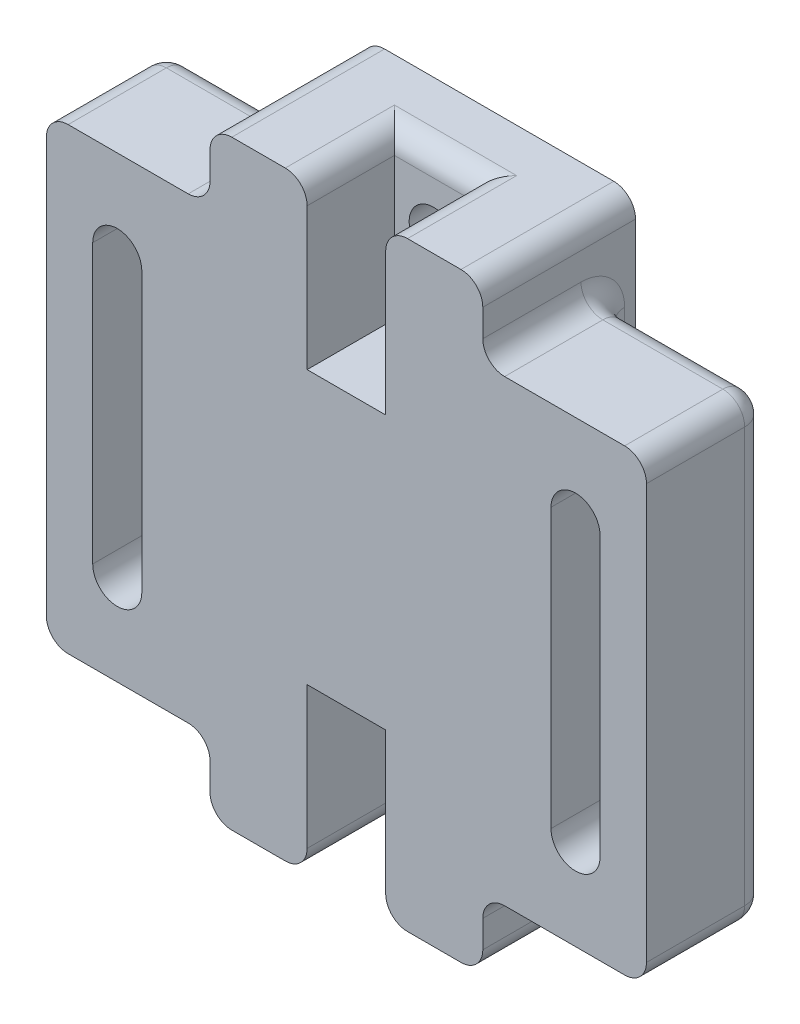
from build123d import *

# Parameters (mm, degrees)
BOSS_EXTRUDE1_DEPTH      = 55
M4_CLEARANCE_HOLE1_D     = 4.5
M4_CLEARANCE_SLOT1_DEPTH = 11
SKETCH6_W                = 7.2
SKETCH6_H                = 8
CUT_EXTRUDE1_DEPTH       = 15
SKETCH7_W                = 15
SKETCH7_H                = 6.5
CUT_EXTRUDE3_DEPTH       = 79.555712714
MIRROR3_COPY_1_SKETCH_W  = 15
MIRROR3_COPY_1_SKETCH_H  = 6.5
MIRROR3_COPY_1_DEPTH     = 79.555712714
FILLET1_R                = 2


# Read off the part's stored shape, not the designer's step: M4 Clearance Slot1
with BuildPart() as part:
    # Sketch1 → Boss-Extrude1 (new body)
    with BuildSketch(Plane(origin=(0, 0, 0), x_dir=(1, 0, 0), z_dir=(0, 1, 0))):
        Polygon((0, 0), (15, 0), (15, 3), (40, 3), (40, 0), (55, 0), (55, -11), (0, -11), align=None)
    extrude(amount=BOSS_EXTRUDE1_DEPTH)

    # M4 Clearance Hole1 (through all)
    with Locations(Plane(origin=(0, 0, -3), x_dir=(-1, 0, 0), z_dir=(0, 0, -1))):
        with Locations((-27.5, 48.435), (-27.5, 6.565)):
            Hole(M4_CLEARANCE_HOLE1_D / 2)

    # M4 Clearance Slot1 outline → M4 Clearance Slot1 (cut)
    with BuildSketch(Plane.XY):
        with BuildLine():
            ThreePointArc((46.25, 14.75), (48.5, 12.5), (50.75, 14.75))
            Line((50.75, 14.75), (50.75, 40.25))
            ThreePointArc((50.75, 40.25), (48.5, 42.5), (46.25, 40.25))
            Line((46.25, 40.25), (46.25, 14.75))
        make_face()
        with BuildLine():
            ThreePointArc((4.25, 14.75), (6.5, 12.5), (8.75, 14.75))
            Line((8.75, 14.75), (8.75, 40.25))
            ThreePointArc((8.75, 40.25), (6.5, 42.5), (4.25, 40.25))
            Line((4.25, 40.25), (4.25, 14.75))
        make_face()
    extrude(amount=M4_CLEARANCE_SLOT1_DEPTH, mode=Mode.SUBTRACT)

    # Sketch6 → Cut-Extrude1 (cut)
    with BuildSketch(Plane(origin=(0, 55, 0), x_dir=(1, 0, 0), z_dir=(0, 1, 0))):
        with Locations((27.5, -7)):
            Rectangle(SKETCH6_W, SKETCH6_H)
    cut_extrude1 = extrude(amount=-CUT_EXTRUDE1_DEPTH, mode=Mode.SUBTRACT)

    # Mirror1: Cut-Extrude1 across plane
    add(cut_extrude1.mirror(Plane.ZX.offset(27.5)), mode=Mode.SUBTRACT)

    # Sketch7 → Cut-Extrude3 (cut, through all)
    with BuildSketch(Plane(origin=(0, 0, 0), x_dir=(-1, 0, 0), z_dir=(0, 0, -1))):
        with Locations((-7.5, 3.25)):
            Rectangle(SKETCH7_W, SKETCH7_H)
    cut_extrude3 = extrude(amount=-CUT_EXTRUDE3_DEPTH, mode=Mode.SUBTRACT)

    # Mirror2: Cut-Extrude3 across plane
    add(cut_extrude3.mirror(Plane(origin=(0, 27.5, 0), x_dir=(0, 0, 1), z_dir=(0, -1, 0))), mode=Mode.SUBTRACT)

    # Mirror3: Cut-Extrude3 across plane
    add(cut_extrude3.mirror(Plane(origin=(27.5, 0, 0), x_dir=(0, 0, 1), z_dir=(1, 0, 0))), mode=Mode.SUBTRACT)

    # Mirror3 copy 1 sketch → Mirror3 copy 1 (cut, through all)
    with BuildSketch(Plane(origin=(55, 55, 0), x_dir=(1, 0, 0), z_dir=(0, 0, -1))):
        with Locations((-7.5, 3.25)):
            Rectangle(MIRROR3_COPY_1_SKETCH_W, MIRROR3_COPY_1_SKETCH_H)
    extrude(amount=-MIRROR3_COPY_1_DEPTH, mode=Mode.SUBTRACT)

    # Fillet1
    fillet1_edges = [part.edges().sort_by_distance(p)[0] for p in [
        (7.5, 6.5, 0),
        (15, 27.5, 0),
        (0, 27.5, 0),
        (15, 48.5, 5.5),
        (7.5, 48.5, 0),
        (0, 48.5, 5.5),
        (40, 27.5, 0),
        (55, 27.5, 0),
        (40, 48.5, 5.5),
        (55, 48.5, 5.5),
        (47.5, 48.5, 0),
        (40, 6.5, 5.5),
        (47.5, 6.5, 0),
        (55, 6.5, 5.5),
        (40, 55, 4),
        (15, 55, 4),
        (23.9, 55, 7),
        (31.1, 55, 7),
        (27.5, 55, 3),
        (27.5, 0, 3),
        (23.9, 0, 7),
        (31.1, 0, 7),
        (15, 0, 4),
        (40, 0, 4),
        (15, 6.5, 5.5),
        (0, 6.5, 5.5),
    ]]
    fillet(fillet1_edges, radius=FILLET1_R)


solid = part.part
